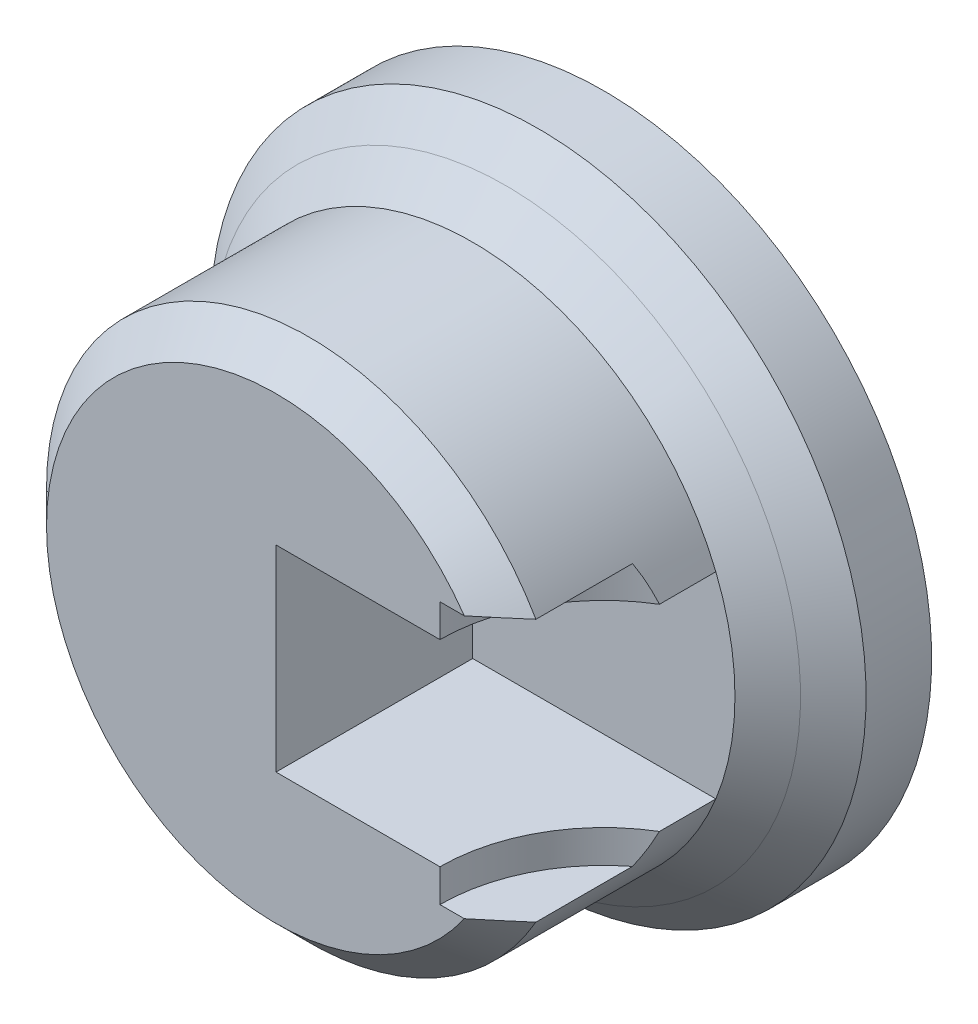
from build123d import *

# Parameters (mm, degrees)
BOSS_EXTRUDE1_DEPTH      = 2.5
BOSS_EXTRUDE1_DEPTH_BACK = 2.5
SKETCH1_R                = 4
SKETCH2_W                = 8
SKETCH2_H                = 3
CUT_EXTRUDE1_DEPTH       = 3
CUT_EXTRUDE2_DEPTH       = 2
CUT_EXTRUDE2_DEPTH_BACK  = 2
SKETCH3_R                = 2.5
CHAMFER1_SIZE            = 0.5
SKETCH4_R                = 5
BOSS_EXTRUDE2_DEPTH      = 1.5
CHAMFER2_SIZE            = 0.5
CHAMFER3_SIZE            = 0.5


with BuildPart() as part:
    # Sketch1 → Boss-Extrude1 (new, two sides: drawn at the far end of the back side and taken through both)
    with BuildSketch(Plane.XY.offset(-BOSS_EXTRUDE1_DEPTH_BACK)):
        Circle(SKETCH1_R)
    extrude(amount=BOSS_EXTRUDE1_DEPTH + BOSS_EXTRUDE1_DEPTH_BACK)

    # Sketch2 → Cut-Extrude1 (cut)
    with BuildSketch(Plane.XY.offset(2.5)):
        with Locations((4, 0)):
            Rectangle(SKETCH2_W, SKETCH2_H)
    extrude(amount=-CUT_EXTRUDE1_DEPTH, mode=Mode.SUBTRACT)

    # Sketch3 → Cut-Extrude2 (cut, two sides: drawn at the far end of the back side and taken through both)
    with BuildSketch(Plane(origin=(0, 0, 0), x_dir=(1, 0, 0), z_dir=(0, 1, 0)).offset(-CUT_EXTRUDE2_DEPTH_BACK)):
        with Locations((5, -2.5)):
            Circle(SKETCH3_R)
    extrude(amount=CUT_EXTRUDE2_DEPTH + CUT_EXTRUDE2_DEPTH_BACK, mode=Mode.SUBTRACT)

    # Chamfer1
    chamfer1_edges = [part.edges().sort_by_distance(p)[0] for p in [
        (-4, 0, 2.5),
    ]]
    chamfer(chamfer1_edges, length=CHAMFER1_SIZE)

    # Sketch4 → Boss-Extrude2 (add)
    with BuildSketch(Plane(origin=(0, 0, -2.5), x_dir=(-1, 0, 0), z_dir=(0, 0, -1))):
        Circle(SKETCH4_R)
    extrude(amount=-BOSS_EXTRUDE2_DEPTH)

    # Chamfer2
    chamfer2_edges = [part.edges().sort_by_distance(p)[0] for p in [
        (-4, 0, -1),
    ]]
    chamfer(chamfer2_edges, length=CHAMFER2_SIZE - 0.0001)  # a hair under: the kernel refuses the full size

    # Chamfer3
    chamfer3_edges = [part.edges().sort_by_distance(p)[0] for p in [
        (5, 0, -1),
    ]]
    chamfer(chamfer3_edges, length=CHAMFER3_SIZE)


solid = part.part
